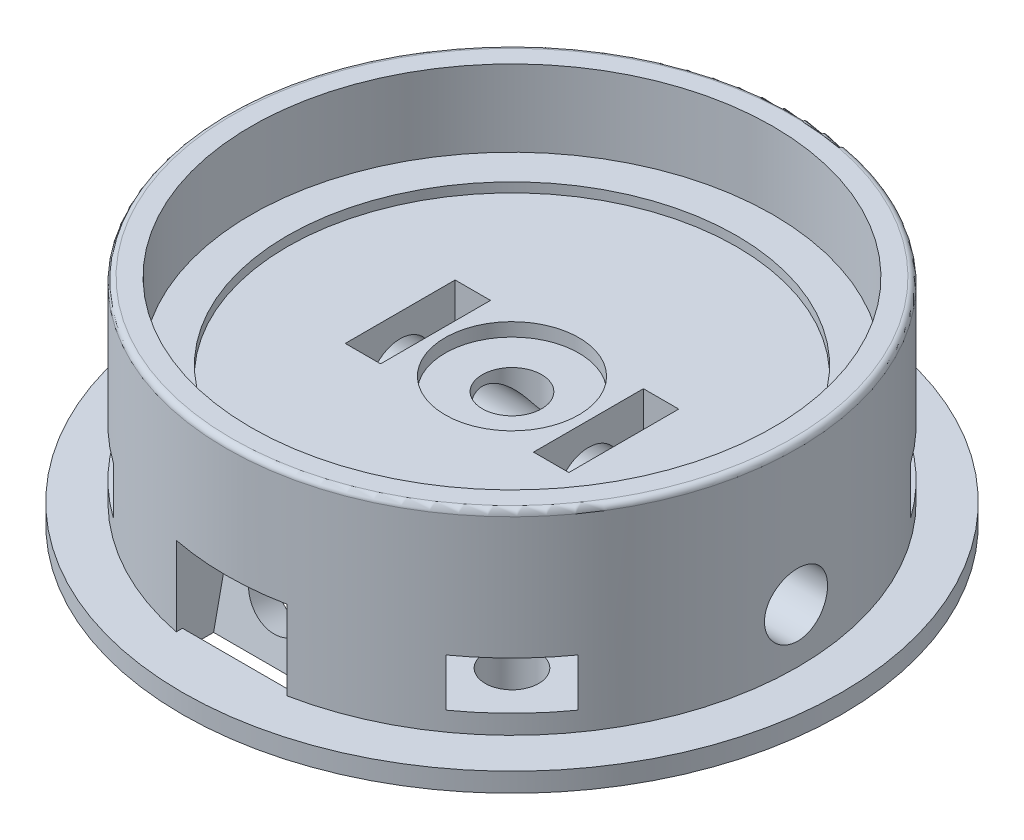
from build123d import *

# Parameters (mm, degrees)
SKETCH1_R           = 14.95
BOSS_EXTRUDE1_DEPTH = 6.2
SKETCH2_R           = 11.75
CUT_EXTRUDE1_DEPTH  = 0.5
SKETCH3_R           = 14.95
SKETCH3_R_2         = 13.65
BOSS_EXTRUDE2_DEPTH = 4
FILLET1_R           = 0.3
SKETCH4_R           = 1.55
CUT_EXTRUDE2_DEPTH  = 22.897374272
SKETCH5_R           = 1.65
CUT_EXTRUDE3_DEPTH  = 24.474347701
SKETCH6_R           = 17.25
SKETCH6_R_2         = 1.55
BOSS_EXTRUDE3_DEPTH = 1
SKETCH7_W           = 5.75
SKETCH7_H           = 5.75
CUT_EXTRUDE4_DEPTH  = 1.85
CIRPATTERN1_COUNT   = 2
CUT_EXTRUDE5_START  = -2
SKETCH9_R           = 1.65
CUT_EXTRUDE5_DEPTH  = 38.679179551
CUT_EXTRUDE6_DEPTH  = 1.8
CUT_EXTRUDE11_REACH = 39.927
SKETCH19_W          = 5.8
SKETCH19_H          = 4.150072675
CIRPATTERN2_COUNT   = 2
SKETCH16_R          = 1.4
CUT_EXTRUDE8_DEPTH  = 4.5
CUT_EXTRUDE9_DEPTH  = 2.5
CIRPATTERN3_COUNT   = 4
SKETCH18_R          = 3.5
CUT_EXTRUDE10_DEPTH = 0.7


with BuildPart() as part:
    # Sketch1 → Boss-Extrude1 (new body)
    with BuildSketch(Plane(origin=(0, 0, 0), x_dir=(1, 0, 0), z_dir=(0, 1, 0))):
        Circle(SKETCH1_R)
    extrude(amount=BOSS_EXTRUDE1_DEPTH)

    # Sketch2 → Cut-Extrude1 (cut)
    with BuildSketch(Plane(origin=(0, 6.2, 0), x_dir=(1, 0, 0), z_dir=(0, 1, 0))):
        Circle(SKETCH2_R)
    extrude(amount=-CUT_EXTRUDE1_DEPTH, mode=Mode.SUBTRACT)

    # Sketch3 → Boss-Extrude2 (add)
    with BuildSketch(Plane(origin=(0, 6.2, 0), x_dir=(1, 0, 0), z_dir=(0, 1, 0))):
        Circle(SKETCH3_R)
        Circle(SKETCH3_R_2, mode=Mode.SUBTRACT)
    extrude(amount=BOSS_EXTRUDE2_DEPTH)

    # Fillet1
    fillet1_edges = [part.edges().sort_by_distance(p)[0] for p in [
        (-14.95, 10.2, 0),
    ]]
    fillet(fillet1_edges, radius=FILLET1_R)

    # Sketch4 → Cut-Extrude2 (cut, through all)
    with BuildSketch(Plane(origin=(0, 5.7, 0), x_dir=(1, 0, 0), z_dir=(0, 1, 0))):
        Circle(SKETCH4_R)
    extrude(amount=-CUT_EXTRUDE2_DEPTH, mode=Mode.SUBTRACT)

    # Sketch5 → Cut-Extrude3 (cut, through all)
    with BuildSketch(Plane(origin=(0, 0, 0), x_dir=(0, 0, -1), z_dir=(1, 0, 0))):
        with Locations((0, 2.825)):
            Circle(SKETCH5_R)
    cut_extrude3 = extrude(amount=CUT_EXTRUDE3_DEPTH, mode=Mode.SUBTRACT)

    # Sketch6 → Boss-Extrude3 (add)
    with BuildSketch(Plane.XZ):
        Circle(SKETCH6_R)
        Circle(SKETCH6_R_2, mode=Mode.SUBTRACT)
    extrude(amount=BOSS_EXTRUDE3_DEPTH)

    # Sketch7 → Cut-Extrude4 (cut)
    with BuildSketch(Plane(origin=(4, 0, 0), x_dir=(0, 0, -1), z_dir=(1, 0, 0))):
        with Locations((0, 2.825)):
            Rectangle(SKETCH7_W, SKETCH7_H)
    cut_extrude4 = extrude(amount=CUT_EXTRUDE4_DEPTH, mode=Mode.SUBTRACT)

    # CirPattern1: Cut-Extrude3, Cut-Extrude4 ×2 about axis
    cirpattern1_axis = Axis((0, 9.9, 0), (0, -1, 0))
    add([cut_extrude3.rotate(cirpattern1_axis, i * 360 / CIRPATTERN1_COUNT) for i in range(1, CIRPATTERN1_COUNT)], mode=Mode.SUBTRACT)
    add([cut_extrude4.rotate(cirpattern1_axis, i * 360 / CIRPATTERN1_COUNT) for i in range(1, CIRPATTERN1_COUNT)], mode=Mode.SUBTRACT)

    # Sketch9 → Cut-Extrude5 (cut)
    with BuildSketch(Plane(origin=(0, 0.418934665, 12.410952688), x_dir=(0, -0.9781476007338056, 0.2079116908177598), z_dir=(0, 0.2079116908177598, 0.9781476007338056)).offset(CUT_EXTRUDE5_START)):
        with Locations((-1.471706086, 0)):
            Circle(SKETCH9_R)
    cut_extrude5 = extrude(amount=CUT_EXTRUDE5_DEPTH, mode=Mode.SUBTRACT)

    # Sketch10 → Cut-Extrude6 (cut)
    with BuildSketch(Plane(origin=(0, 0, 12.5), x_dir=(0, -0.9781476007338056, 0.2079116908177598), z_dir=(0, 0.2079116908177598, 0.9781476007338056))):
        Polygon((1, 2.9), (-4.8, 2.9), (-4.8, -2.9), (1, -2.9), (3, -2.9), (3, 2.9), align=None)
    cut_extrude6 = extrude(amount=CUT_EXTRUDE6_DEPTH, mode=Mode.SUBTRACT)

    # Cut-Sweep1: sweep along a path in Sketch14
    with BuildLine(Plane(origin=(0, 0, 0), x_dir=(0, -1, 0), z_dir=(-1, 0, 0))) as cut_sweep1_path:
        ThreePointArc((-3.160556446, 10.294692096), (-0.851753645, 4.580204634), (3.272281132, 0))
    # Sketch13 → Cut-Sweep1 (sweep, cut)
    with BuildSketch(Plane(origin=(0, 2.230236483, 10.492437709), x_dir=(-1, 0, 0), z_dir=(0, 0.2079116908177598, 0.9781476007338056))):
        with BuildLine():
            Line((-2.490185445, -0.207457245), (-3.875584776, 3.598896135))
            Line((-3.875584776, 3.598896135), (3.875584776, 3.598896135))
            Line((3.875584776, 3.598896135), (2.490185445, -0.207457245))
            ThreePointArc((2.490185445, -0.207457245), (0, -1.951103865), (-2.490185445, -0.207457245))
        make_face()
    cut_sweep1 = sweep(path=cut_sweep1_path.line, mode=Mode.SUBTRACT)

    # Cut-Extrude11: up to this plane
    cut_extrude11_end = Plane(origin=(0, 2.916345063, 13.720324792), z_dir=(0, -0.20791169081775973, -0.9781476007338056))
    # Sketch19 → Cut-Extrude11 (cut, up to the surface)
    with BuildSketch(Plane.XY.offset(14.95), mode=Mode.PRIVATE) as cut_extrude11_sk1:
        with Locations((0, 2.075036338)):
            Rectangle(SKETCH19_W, SKETCH19_H)
    cut_extrude11_tool1 = split(extrude(cut_extrude11_sk1.sketch, amount=-CUT_EXTRUDE11_REACH, mode=Mode.PRIVATE), bisect_by=cut_extrude11_end, keep=Keep.BOTH, mode=Mode.PRIVATE)
    cut_extrude11 = cut_extrude11_tool1.solids().sort_by_distance((0, 2.075036, 14.95))[0]
    add(cut_extrude11, mode=Mode.SUBTRACT)

    # CirPattern2: Cut-Extrude5, Cut-Extrude6, Cut-Sweep1, Cut-Extrude11 ×2 about axis
    cirpattern2_axis = Axis((0, 9.9, 0), (0, -1, 0))
    add([cut_extrude5.rotate(cirpattern2_axis, i * 360 / CIRPATTERN2_COUNT) for i in range(1, CIRPATTERN2_COUNT)], mode=Mode.SUBTRACT)
    add([cut_extrude6.rotate(cirpattern2_axis, i * 360 / CIRPATTERN2_COUNT) for i in range(1, CIRPATTERN2_COUNT)], mode=Mode.SUBTRACT)
    add([cut_sweep1.rotate(cirpattern2_axis, i * 360 / CIRPATTERN2_COUNT) for i in range(1, CIRPATTERN2_COUNT)], mode=Mode.SUBTRACT)
    add([cut_extrude11.rotate(cirpattern2_axis, i * 360 / CIRPATTERN2_COUNT) for i in range(1, CIRPATTERN2_COUNT)], mode=Mode.SUBTRACT)

    # Sketch16 → Cut-Extrude8 (cut)
    with BuildSketch(Plane.XZ.offset(1)):
        with Locations((-8.520636713, 8.520636713)):
            Circle(SKETCH16_R)
    cut_extrude8 = extrude(amount=-CUT_EXTRUDE8_DEPTH, mode=Mode.SUBTRACT)

    # Sketch17 → Cut-Extrude9 (cut)
    with BuildSketch(Plane.XZ.offset(-3.5)):
        Polygon((-11.253256639, 7.788433411), (-9.252840016, 5.788016788), (-6.52022009, 6.52022009), (-5.788016788, 9.252840016), (-7.788433411, 11.253256639), (-8.838834765, 12.303657993), (-12.303657993, 8.838834765), align=None)
    cut_extrude9 = extrude(amount=CUT_EXTRUDE9_DEPTH, mode=Mode.SUBTRACT)

    # CirPattern3: Cut-Extrude8, Cut-Extrude9 ×4 about axis
    cirpattern3_axis = Axis((0, 9.9, 0), (0, -1, 0))
    add([cut_extrude8.rotate(cirpattern3_axis, i * 360 / CIRPATTERN3_COUNT) for i in range(1, CIRPATTERN3_COUNT)], mode=Mode.SUBTRACT)
    add([cut_extrude9.rotate(cirpattern3_axis, i * 360 / CIRPATTERN3_COUNT) for i in range(1, CIRPATTERN3_COUNT)], mode=Mode.SUBTRACT)

    # Sketch18 → Cut-Extrude10 (cut)
    with BuildSketch(Plane(origin=(0, 5.7, 0), x_dir=(1, 0, 0), z_dir=(0, 1, 0))):
        Circle(SKETCH18_R)
    extrude(amount=-CUT_EXTRUDE10_DEPTH, mode=Mode.SUBTRACT)


solid = part.part
